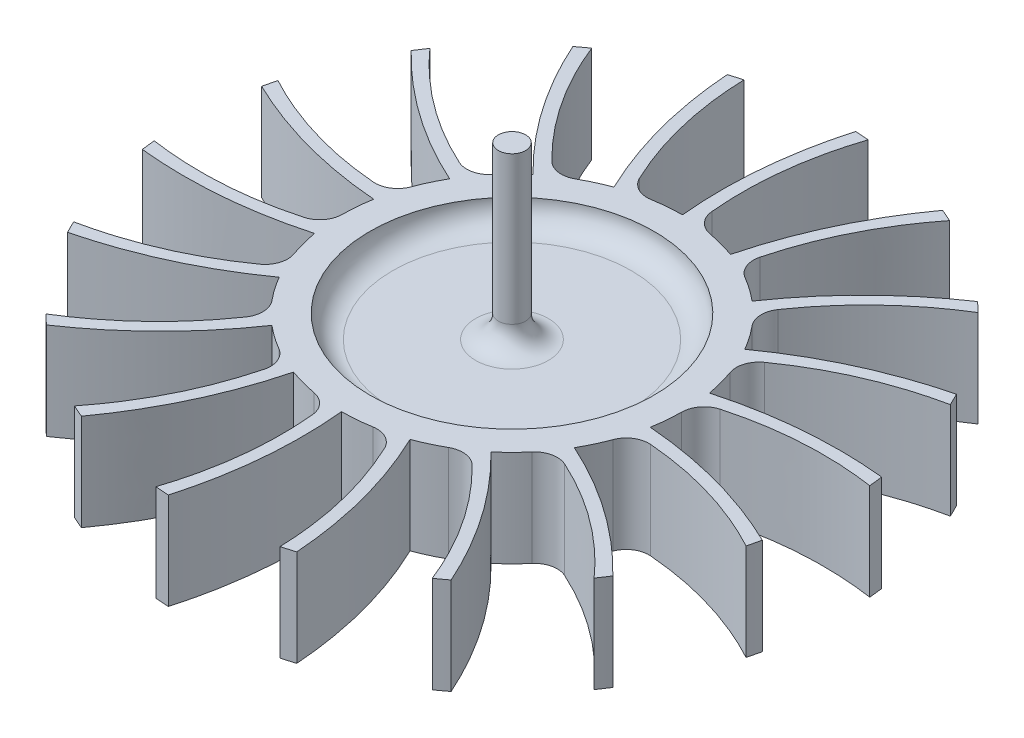
from build123d import *

# Parameters (mm, degrees)
SKETCH1_R           = 36.83
BOSS_EXTRUDE1_DEPTH = 10.795
SKETCH2_R           = 15.875
CUT_EXTRUDE1_DEPTH  = 2.54
SKETCH3_R           = 3.5
CUT_EXTRUDE2_DEPTH  = 3
CUT_EXTRUDE5_DEPTH  = 54.192385028
SKETCH5_R           = 1.524
BOSS_EXTRUDE2_DEPTH = 6.35
SKETCH6_R           = 12.7
SKETCH6_R_2         = 4.675
CUT_EXTRUDE6_DEPTH  = 3.048
FILLET1_R           = 2.54
FILLET2_R           = 2.54
FILLET3_R           = 2.54
SKETCH7_R           = 1.524
BOSS_EXTRUDE3_DEPTH = 12.7
FILLET4_R           = 2.54


with BuildPart() as part:
    # Sketch1 → Boss-Extrude1 (new body)
    with BuildSketch(Plane(origin=(0, 0, 0), x_dir=(1, 0, 0), z_dir=(0, 1, 0))):
        with Locations(Location((0, 0, 0), (0, 0, 270))):
            Circle(SKETCH1_R)
    extrude(amount=BOSS_EXTRUDE1_DEPTH)

    # Sketch2 → Cut-Extrude1 (cut)
    with BuildSketch(Plane(origin=(0, 10.795, 0), x_dir=(1, 0, 0), z_dir=(0, 1, 0))):
        with Locations(Location((0, 0, 0), (0, 0, 270))):
            Circle(SKETCH2_R)
    extrude(amount=-CUT_EXTRUDE1_DEPTH, mode=Mode.SUBTRACT)

    # Sketch3 → Cut-Extrude2 (cut)
    with BuildSketch(Plane.XZ):
        with Locations(Location((0, 0, 0), (0, 0, 270))):
            Circle(SKETCH3_R)
    extrude(amount=-CUT_EXTRUDE2_DEPTH, mode=Mode.SUBTRACT)

    # Sketch4 → Cut-Extrude5 (cut, through all)
    with BuildSketch(Plane(origin=(0, 10.795, 0), x_dir=(1, 0, 0), z_dir=(0, 1, 0))):
        with BuildLine():
            ThreePointArc((-5.024268952, 18.37550602), (-2.534670621, 18.880623529), (0, 19.05))
            add(Edge.make_bspline(
                [(0, 19.05), (-0.870734714, 28.080728745), (1.610389845, 36.79477605)],
                knots=[0, 0, 0, 1, 1, 1], degree=2))
            ThreePointArc((1.610389845, 36.79477605), (-4.054648178, 36.606129653), (-9.623649615, 35.550446806))
            add(Edge.make_bspline(
                [(-5.024268952, 18.37550602), (-9.350973869, 26.431974195), (-9.623649615, 35.550446806)],
                knots=[0, 0, 0, 1, 1, 1], degree=2))
        make_face()
        with BuildLine():
            ThreePointArc((1.563524743, 18.985728597), (4.075742286, 18.608891015), (6.51548373, 17.901144426))
            add(Edge.make_bspline(
                [(6.51548373, 17.901144426), (8.785951885, 26.6850624), (14.097826032, 34.024993772)],
                knots=[0, 0, 0, 1, 1, 1], degree=2))
            ThreePointArc((14.097826032, 34.024993772), (8.709910737, 35.785281261), (3.115696384, 36.69797455))
            add(Edge.make_bspline(
                [(1.563524743, 18.985728597), (0.25322646, 28.036152527), (3.115696384, 36.69797455)],
                knots=[0, 0, 0, 1, 1, 1], degree=2))
        make_face()
        with BuildLine():
            ThreePointArc((7.96273428, 17.305992107), (10.194560523, 16.092651607), (12.245103965, 14.593146641))
            add(Edge.make_bspline(
                [(12.245103965, 14.593146641), (17.382923019, 22.070783699), (24.884856338, 27.15129509)],
                knots=[0, 0, 0, 1, 1, 1], degree=2))
            ThreePointArc((24.884856338, 27.15129509), (20.423925873, 30.648199815), (15.479243416, 33.419184958))
            add(Edge.make_bspline(
                [(7.96273428, 17.305992107), (9.826883942, 26.258757095), (15.479243416, 33.419184958)],
                knots=[0, 0, 0, 1, 1, 1], degree=2))
        make_face()
        with BuildLine():
            ThreePointArc((13.401520545, 13.538897558), (15.083764305, 11.635400913), (16.497783942, 9.525))
            add(Edge.make_bspline(
                [(16.497783942, 9.525), (23.883257093, 14.794442755), (32.670405708, 17.002749509)],
                knots=[0, 0, 0, 1, 1, 1], degree=2))
            ThreePointArc((32.670405708, 17.002749509), (29.674514124, 21.814493152), (25.975765242, 26.109548446))
            add(Edge.make_bspline(
                [(13.401520545, 13.538897558), (18.21527419, 21.314168019), (25.975765242, 26.109548446)],
                knots=[0, 0, 0, 1, 1, 1], degree=2))
        make_face()
        with BuildLine():
            ThreePointArc((17.223885646, 8.138812152), (18.153643499, 5.774749148), (18.760587695, 3.307997785))
            add(Edge.make_bspline(
                [(18.760587695, 3.307997785), (27.502917882, 5.733673671), (36.515421986, 4.803421404)],
                knots=[0, 0, 0, 1, 1, 1], degree=2))
            ThreePointArc((36.515421986, 4.803421404), (35.345918022, 10.349636668), (33.339226419, 15.650715056))
            add(Edge.make_bspline(
                [(17.223885646, 8.138812152), (24.406633543, 13.798775716), (33.339226419, 15.650715056)],
                knots=[0, 0, 0, 1, 1, 1], degree=2))
        make_face()
        with BuildLine():
            ThreePointArc((18.968795942, 1.757065883), (19.029688157, 0.879470667), (19.05, 0))
            ThreePointArc((19.05, 0), (18.977508999, -1.660316899), (18.760587695, -3.307997785))
            add(Edge.make_bspline(
                [(18.760587695, -3.307997785), (27.805320875, -4.018661077), (35.956139462, -7.975270213)],
                knots=[0, 0, 0, 1, 1, 1], degree=2))
            ThreePointArc((35.956139462, -7.975270213), (36.610883057, -4.011501191), (36.83, 0))
            ThreePointArc((36.83, 0), (36.79285248, 1.653755238), (36.681484856, 3.30417445))
            add(Edge.make_bspline(
                [(18.968795942, 1.757065883), (27.654192687, 4.619047414), (36.681484856, 3.30417445)],
                knots=[0, 0, 0, 1, 1, 1], degree=2))
        make_face()
        with BuildLine():
            add(Edge.make_bspline(
                [(18.425789497, -4.836608462), (27.56624806, -5.117806177), (35.599414857, -9.440898359)],
                knots=[0, 0, 0, 1, 1, 1], degree=2))
            ThreePointArc((18.425789497, -4.836608462), (17.618434926, -7.245222616), (16.497783942, -9.525))
            add(Edge.make_bspline(
                [(16.497783942, -9.525), (24.753991807, -13.28628599), (31.060015863, -19.792026541)],
                knots=[0, 0, 0, 1, 1, 1], degree=2))
            ThreePointArc((31.060015863, -19.792026541), (33.729162303, -14.7916365), (35.599414857, -9.440898359))
        make_face()
        with BuildLine():
            add(Edge.make_bspline(
                [(15.660360903, -10.846916446), (24.153407083, -14.237376811), (30.223530036, -21.047259494)],
                knots=[0, 0, 0, 1, 1, 1], degree=2))
            ThreePointArc((15.660360903, -10.846916446), (14.077901212, -12.834141867), (12.245103965, -14.593146641))
            add(Edge.make_bspline(
                [(12.245103965, -14.593146641), (18.716965997, -20.951388728), (22.417595954, -29.221572368)],
                knots=[0, 0, 0, 1, 1, 1], degree=2))
            ThreePointArc((22.417595954, -29.221572368), (26.636007285, -25.435644594), (30.223530036, -21.047259494))
        make_face()
        with BuildLine():
            add(Edge.make_bspline(
                [(11.006061662, -15.548926223), (17.827308745, -21.639709681), (21.20224144, -30.115010508)],
                knots=[0, 0, 0, 1, 1, 1], degree=2))
            ThreePointArc((11.006061662, -15.548926223), (8.839364844, -16.875074197), (6.51548373, -17.901144426))
            add(Edge.make_bspline(
                [(6.51548373, -17.901144426), (10.422397855, -26.089444776), (11.071283124, -35.126565303)],
                knots=[0, 0, 0, 1, 1, 1], degree=2))
            ThreePointArc((11.071283124, -35.126565303), (16.330156684, -33.011738559), (21.20224144, -30.115010508))
        make_face()
        with BuildLine():
            add(Edge.make_bspline(
                [(5.024268952, -18.37550602), (9.350973869, -26.431974195), (9.623649615, -35.550446806)],
                knots=[0, 0, 0, 1, 1, 1], degree=2))
            ThreePointArc((5.024268952, -18.37550602), (2.534670621, -18.880623529), (0, -19.05))
            add(Edge.make_bspline(
                [(0, -19.05), (0.870734714, -28.080728745), (-1.610389845, -36.79477605)],
                knots=[0, 0, 0, 1, 1, 1], degree=2))
            ThreePointArc((-1.610389845, -36.79477605), (4.054648178, -36.606129653), (9.623649615, -35.550446806))
        make_face()
        with BuildLine():
            add(Edge.make_bspline(
                [(-1.563524743, -18.985728597), (-0.25322646, -28.036152527), (-3.115696384, -36.69797455)],
                knots=[0, 0, 0, 1, 1, 1], degree=2))
            ThreePointArc((-1.563524743, -18.985728597), (-4.075742286, -18.608891015), (-6.51548373, -17.901144426))
            add(Edge.make_bspline(
                [(-6.51548373, -17.901144426), (-8.785951885, -26.6850624), (-14.097826032, -34.024993772)],
                knots=[0, 0, 0, 1, 1, 1], degree=2))
            ThreePointArc((-14.097826032, -34.024993772), (-8.709910737, -35.785281261), (-3.115696384, -36.69797455))
        make_face()
        with BuildLine():
            add(Edge.make_bspline(
                [(-7.96273428, -17.305992107), (-9.826883942, -26.258757095), (-15.479243416, -33.419184958)],
                knots=[0, 0, 0, 1, 1, 1], degree=2))
            ThreePointArc((-7.96273428, -17.305992107), (-10.194560523, -16.092651607), (-12.245103965, -14.593146641))
            add(Edge.make_bspline(
                [(-12.245103965, -14.593146641), (-17.382923019, -22.070783699), (-24.884856338, -27.15129509)],
                knots=[0, 0, 0, 1, 1, 1], degree=2))
            ThreePointArc((-24.884856338, -27.15129509), (-20.423925873, -30.648199815), (-15.479243416, -33.419184958))
        make_face()
        with BuildLine():
            add(Edge.make_bspline(
                [(-13.401520545, -13.538897558), (-18.21527419, -21.314168019), (-25.975765242, -26.109548446)],
                knots=[0, 0, 0, 1, 1, 1], degree=2))
            ThreePointArc((-13.401520545, -13.538897558), (-15.083764305, -11.635400913), (-16.497783942, -9.525))
            add(Edge.make_bspline(
                [(-16.497783942, -9.525), (-23.883257093, -14.794442755), (-32.670405708, -17.002749509)],
                knots=[0, 0, 0, 1, 1, 1], degree=2))
            ThreePointArc((-32.670405708, -17.002749509), (-29.674514124, -21.814493152), (-25.975765242, -26.109548446))
        make_face()
        with BuildLine():
            add(Edge.make_bspline(
                [(-17.223885646, -8.138812152), (-24.406633543, -13.798775716), (-33.339226419, -15.650715056)],
                knots=[0, 0, 0, 1, 1, 1], degree=2))
            ThreePointArc((-17.223885646, -8.138812152), (-18.153643499, -5.774749148), (-18.760587695, -3.307997785))
            add(Edge.make_bspline(
                [(-18.760587695, -3.307997785), (-27.502917882, -5.733673671), (-36.515421986, -4.803421404)],
                knots=[0, 0, 0, 1, 1, 1], degree=2))
            ThreePointArc((-36.515421986, -4.803421404), (-35.345918022, -10.349636668), (-33.339226419, -15.650715056))
        make_face()
        with BuildLine():
            ThreePointArc((-18.968795942, -1.757065883), (-19.033925367, 0.78242259), (-18.760587695, 3.307997785))
            add(Edge.make_bspline(
                [(-18.760587695, 3.307997785), (-27.805320875, 4.018661077), (-35.956139462, 7.975270213)],
                knots=[0, 0, 0, 1, 1, 1], degree=2))
            ThreePointArc((-35.956139462, 7.975270213), (-36.754082557, 2.363538744), (-36.681484856, -3.30417445))
            add(Edge.make_bspline(
                [(-18.968795942, -1.757065883), (-27.654192687, -4.619047414), (-36.681484856, -3.30417445)],
                knots=[0, 0, 0, 1, 1, 1], degree=2))
        make_face()
        with BuildLine():
            ThreePointArc((-18.425789497, 4.836608462), (-17.618434926, 7.245222616), (-16.497783942, 9.525))
            add(Edge.make_bspline(
                [(-16.497783942, 9.525), (-24.753991807, 13.28628599), (-31.060015863, 19.792026541)],
                knots=[0, 0, 0, 1, 1, 1], degree=2))
            ThreePointArc((-31.060015863, 19.792026541), (-33.729162303, 14.7916365), (-35.599414857, 9.440898359))
            add(Edge.make_bspline(
                [(-18.425789497, 4.836608462), (-27.56624806, 5.117806177), (-35.599414857, 9.440898359)],
                knots=[0, 0, 0, 1, 1, 1], degree=2))
        make_face()
        with BuildLine():
            ThreePointArc((-15.660360903, 10.846916446), (-14.077901212, 12.834141867), (-12.245103965, 14.593146641))
            add(Edge.make_bspline(
                [(-12.245103965, 14.593146641), (-18.716965997, 20.951388728), (-22.417595954, 29.221572368)],
                knots=[0, 0, 0, 1, 1, 1], degree=2))
            ThreePointArc((-22.417595954, 29.221572368), (-26.636007285, 25.435644594), (-30.223530036, 21.047259494))
            add(Edge.make_bspline(
                [(-15.660360903, 10.846916446), (-24.153407083, 14.237376811), (-30.223530036, 21.047259494)],
                knots=[0, 0, 0, 1, 1, 1], degree=2))
        make_face()
        with BuildLine():
            ThreePointArc((-11.006061662, 15.548926223), (-8.839364844, 16.875074197), (-6.51548373, 17.901144426))
            add(Edge.make_bspline(
                [(-6.51548373, 17.901144426), (-10.422397855, 26.089444776), (-11.071283124, 35.126565303)],
                knots=[0, 0, 0, 1, 1, 1], degree=2))
            ThreePointArc((-11.071283124, 35.126565303), (-16.330156684, 33.011738559), (-21.20224144, 30.115010508))
            add(Edge.make_bspline(
                [(-11.006061662, 15.548926223), (-17.827308745, 21.639709681), (-21.20224144, 30.115010508)],
                knots=[0, 0, 0, 1, 1, 1], degree=2))
        make_face()
    extrude(amount=-CUT_EXTRUDE5_DEPTH, mode=Mode.SUBTRACT)

    # Sketch5 → Boss-Extrude2 (add)
    with BuildSketch(Plane(origin=(0, 8.255, 0), x_dir=(1, 0, 0), z_dir=(0, 1, 0))):
        with Locations(Location((0, 0, 0), (0, 0, 270))):
            Circle(SKETCH5_R)
    extrude(amount=BOSS_EXTRUDE2_DEPTH)

    # Sketch6 → Cut-Extrude6 (cut)
    with BuildSketch(Plane(origin=(0, 0, 0), x_dir=(-1, 0, 0), z_dir=(0, -1, 0))):
        with Locations(Location((0, 0, 0), (0, 0, 90))):
            Circle(SKETCH6_R)
        with Locations(Location((0, 0, 0), (0, 0, 90))):
            Circle(SKETCH6_R_2, mode=Mode.SUBTRACT)
    extrude(amount=-CUT_EXTRUDE6_DEPTH, mode=Mode.SUBTRACT)

    # Fillet1
    fillet1_edges = [part.edges().sort_by_distance(p)[0] for p in [
        (11.006061662, 5.3975, 15.548926223),
        (5.024268952, 5.3975, 18.37550602),
        (-1.563524743, 5.3975, 18.985728597),
        (-7.96273428, 5.3975, 17.305992107),
        (-13.401520545, 5.3975, 13.538897558),
        (-17.223885646, 5.3975, 8.138812152),
        (-18.968795942, 5.3975, 1.757065883),
        (-18.425789497, 5.3975, -4.836608462),
        (-15.660360903, 5.3975, -10.846916446),
        (-11.006061662, 5.3975, -15.548926223),
        (-5.024268952, 5.3975, -18.37550602),
        (1.563524743, 5.3975, -18.985728597),
        (7.96273428, 5.3975, -17.305992107),
        (13.401520545, 5.3975, -13.538897558),
        (17.223885646, 5.3975, -8.138812152),
        (18.968795942, 5.3975, -1.757065883),
        (18.425789497, 5.3975, 4.836608462),
        (15.660360903, 5.3975, 10.846916446),
    ]]
    fillet(fillet1_edges, radius=FILLET1_R)

    # Fillet2
    fillet2_edges = [part.edges().sort_by_distance(p)[0] for p in [
        (0, 3.048, 12.7),
        (0, 8.255, -15.875),
    ]]
    fillet(fillet2_edges, radius=FILLET2_R - 0.0001)  # a hair under: the kernel refuses the full size

    # Fillet3
    fillet3_edges = [part.edges().sort_by_distance(p)[0] for p in [
        (0, 3.048, 4.675),
    ]]
    fillet(fillet3_edges, radius=FILLET3_R)

    # Sketch7 → Boss-Extrude3 (add)
    with BuildSketch(Plane(origin=(0, 14.605, 0), x_dir=(1, 0, 0), z_dir=(0, 1, 0))):
        with Locations(Location((0, 0, 0), (0, 0, 270))):
            Circle(SKETCH7_R)
    extrude(amount=BOSS_EXTRUDE3_DEPTH)

    # Fillet4
    fillet4_edges = [part.edges().sort_by_distance(p)[0] for p in [
        (0, 8.255, -1.524),
    ]]
    fillet(fillet4_edges, radius=FILLET4_R)


solid = part.part
